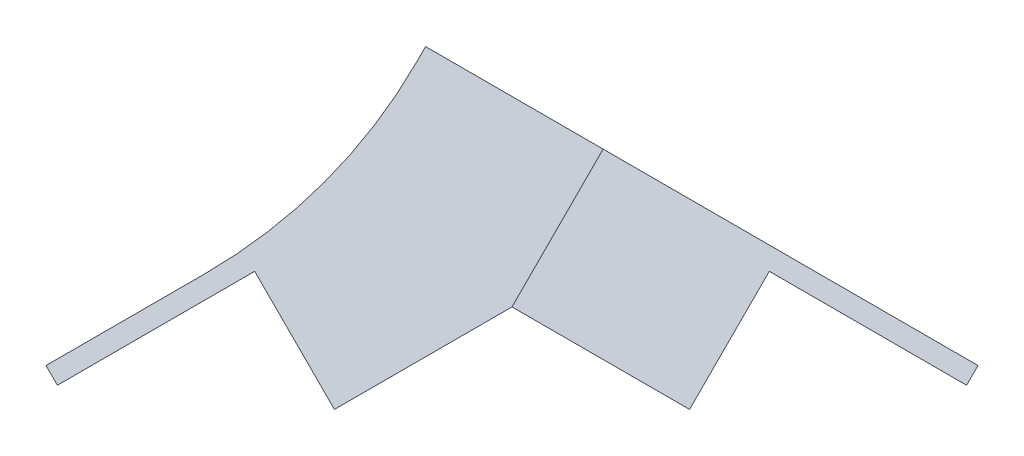
from build123d import *
from build123d.topology import SkipClean

# Parameters (mm, degrees)
STOCK_GOUX_START         = 53.391336338
STOCK_GOUX_LIKED_1_DEPTH = 20.568134432
CUT_EXTRUDE1_DEPTH       = 109.511360444
BOSS_EXTRUDE1_DEPTH      = 20.568134
FILLET1_R                = 12.7
SKETCH3_R                = 0.64999997
CUT_EXTRUDE2_DEPTH       = 149.612005727
CUT_EXTRUDE3_DEPTH       = 0.4


# Read off the part's stored shape, not the designer's step: Stock-Goux Liked-1
with BuildPart() as part:
    # Stock-Goux Liked-1 outline → Stock-Goux Liked-1 (new body)
    with BuildSketch(Plane(origin=(0, 0, 0), x_dir=(0.8164965809277512, -0.4082482904637994, -0.40824829046387656), z_dir=(0.5773502691895902, 0.5773502691895891, 0.5773502691896982)).offset(STOCK_GOUX_START)):
        Polygon((57.433440297, -119.932119095), (57.866453013, -120.182119103), (60.366452966, -115.851992166), (63.397541976, -117.601992222), (65.647541921, -113.704878), (70.147541811, -113.704878), (70.147541811, -110.204877888), (75.147541717, -110.204877888), (75.147541717, -109.704877872), (63.338140771, -109.704877872), align=None)
    extrude(amount=STOCK_GOUX_LIKED_1_DEPTH)

    # Sketch1 → Cut-Extrude1 (cut, through all)
    with BuildSketch(Plane(origin=(0, -80.401490288, 80.401490288), x_dir=(1, 0, 0), z_dir=(0, -0.7071067811865477, 0.7071067811865475))):
        Polygon((84.426495932, 5.692217571), (86.735897009, 8.958203895), (94.492614361, 3.473376455), (92.183213285, 0.207390132), align=None)
        Polygon((96.301513883, 22.486029011), (104.058231236, 17.001201571), (101.748830159, 13.735215248), (93.992112807, 19.220042687), align=None)
    extrude(amount=-CUT_EXTRUDE1_DEPTH, mode=Mode.SUBTRACT)

    # Sketch2 → Boss-Extrude1 (add)
    with SkipClean():  # the faces are left unmerged after this step: merging them gives an invalid solid
        with BuildSketch(Plane(origin=(30.825502407, 30.825502407, 30.825502407), x_dir=(-0.40824829046391425, -0.4082482904639143, 0.8164965809276746), z_dir=(-0.5773502691895895, -0.5773502691895894, -0.5773502691896983))):
            Polygon((62.183440195, -111.704877936), (65.647541921, -113.704878), (67.897541921, -109.807763683), (64.433440195, -107.807763619), align=None)
        extrude(amount=-BOSS_EXTRUDE1_DEPTH)

    # Fillet1
    fillet1_edges = [part.edges().sort_by_distance(p)[0] for p in [
        (86.689770169, -68.456355976, 92.055619581),
    ]]
    fillet(fillet1_edges, radius=FILLET1_R)

    # Sketch3 → Cut-Extrude2 (cut, through all)
    with SkipClean():  # the faces are left unmerged after this step: merging them gives an invalid solid
        with BuildSketch(Plane(origin=(53.600993525, -26.800496763, -26.800496763), x_dir=(-0.36514837167009556, 0.18257418583503127, -0.9128709291752878), z_dir=(0.8164965809277506, -0.40824829046383865, -0.4082482904638387))):
            with Locations(Location((-132.231040931, -15.066915515, 0), (0, 0, 348.463040967))):
                Circle(SKETCH3_R)
        cut_extrude2 = extrude(amount=-CUT_EXTRUDE2_DEPTH, mode=Mode.SUBTRACT)

    # Mirror1: Cut-Extrude2 across plane
    with SkipClean():  # the faces are left unmerged after this step: merging them gives an invalid solid
        add(cut_extrude2.mirror(Plane(origin=(36.763011383, 36.763011383, 36.763011383), x_dir=(-0.40824829046390154, -0.40824829046390165, 0.8164965809276874), z_dir=(0.5773502691895985, 0.5773502691895986, 0.5773502691896802))), mode=Mode.SUBTRACT)

    # Sketch4 → Cut-Extrude3 (cut)
    with SkipClean():  # the faces are left unmerged after this step: merging them gives an invalid solid
        with BuildSketch(Plane(origin=(0, -77.573063073, 77.573063073), x_dir=(1, 0, 0), z_dir=(0, 0.7071067811865477, -0.7071067811865475))):
            with BuildLine():
                Line((93.057379032, -13.173091082), (92.567645459, -13.519084672))
                Line((92.567645459, -13.519084672), (91.270169497, -11.686081867))
                Line((91.270169497, -11.686081867), (89.687757638, -12.423862316))
                add(Edge.make_bspline(
                    [(89.687757638, -12.423862316), (89.741295568, -12.46776154), (89.844942898, -12.552748714), (89.986729771, -12.686351444), (90.109493379, -12.820951582), (90.180253462, -12.914346072), (90.214380234, -12.959389159)],
                    knots=[0, 0, 0, 0, 1.102510947, 2.134417912, 3.100251258, 4, 4, 4, 4], degree=3))
                add(Edge.make_bspline(
                    [(90.214380234, -12.959389159), (90.253760272, -13.017586925), (90.331220007, -13.132060751), (90.424525722, -13.313424806), (90.499954525, -13.496549573), (90.552853451, -13.683170388), (90.588524358, -13.872165751), (90.600192512, -14.064230957), (90.594316704, -14.258572886), (90.567052813, -14.453627198), (90.522232401, -14.646119682), (90.456443819, -14.831644428), (90.37370764, -15.009053992), (90.272718514, -15.178186861), (90.151902914, -15.337992616), (90.012792553, -15.489286627), (89.855636039, -15.632722917), (89.740254809, -15.718962844), (89.681397462, -15.762954864)],
                    knots=[0, 0, 0, 0, 1.053566777, 2.072344485, 3.054154547, 4.020735706, 4.977911009, 5.934388254, 6.901994919, 7.890871114, 8.884708514, 9.862655974, 10.838946315, 11.817700602, 12.812779523, 13.839512687, 14.897909552, 16, 16, 16, 16], degree=3))
                add(Edge.make_bspline(
                    [(89.681397462, -15.762954864), (89.638861949, -15.79180454), (89.554795968, -15.84882222), (89.424554492, -15.926036449), (89.290895408, -15.991410287), (89.155300895, -16.049553503), (89.016642135, -16.097655089), (88.875174038, -16.137099385), (88.731270115, -16.168140221), (88.585356233, -16.187761829), (88.439700765, -16.199777545), (88.296040345, -16.200730613), (88.155005398, -16.193081949), (88.016337233, -16.176925914), (87.879820972, -16.150143257), (87.746101629, -16.112905095), (87.614836668, -16.066952156), (87.486042986, -16.012633338), (87.36135061, -15.94736132), (87.240735277, -15.873163467), (87.122735013, -15.792270246), (87.011070103, -15.699661066), (86.902568847, -15.599581488), (86.800066565, -15.489353904), (86.699506263, -15.37226378), (86.638126187, -15.288079908), (86.606888247, -15.245236515)],
                    knots=[0, 0, 0, 0, 1.059045057, 2.093066608, 3.116885153, 4.123102215, 5.131744447, 6.138757912, 7.148156815, 8.162686115, 9.170608983, 10.158022319, 11.120612269, 12.079785529, 13.032569554, 13.984391495, 14.937776329, 15.896949589, 16.862272095, 17.834843879, 18.814104655, 19.80760772, 20.82157244, 21.85385735, 22.907771379, 24, 24, 24, 24], degree=3))
                add(Edge.make_bspline(
                    [(86.606888247, -15.245236515), (86.571580982, -15.193252636), (86.502142451, -15.091016336), (86.41618388, -14.93004522), (86.344744771, -14.767482877), (86.292163209, -14.601805216), (86.252344887, -14.434043372), (86.233224181, -14.263324381), (86.227400474, -14.090507286), (86.239494355, -13.916834049), (86.265515908, -13.744722824), (86.30797018, -13.577552607), (86.364080119, -13.416020283), (86.435375705, -13.260390942), (86.522836864, -13.111119621), (86.623492387, -12.96724671), (86.738046259, -12.828566566), (86.824857153, -12.744064342), (86.86892751, -12.701166002)],
                    knots=[0, 0, 0, 0, 1.073683973, 2.111606131, 3.114875596, 4.105229039, 5.079452871, 6.057740752, 7.036807216, 8.032083212, 9.029653356, 10.008961322, 10.976446223, 11.949563641, 12.930560464, 13.930051518, 14.949171403, 16, 16, 16, 16], degree=3))
                Line((86.86892751, -12.701166002), (87.244177911, -13.230332668))
                add(Edge.make_bspline(
                    [(87.244177911, -13.230332668), (87.203630602, -13.274365386), (87.125511073, -13.359199998), (87.030245223, -13.496920616), (86.953711988, -13.633102202), (86.89891325, -13.771272529), (86.866072042, -13.912811297), (86.849115424, -14.058372065), (86.851210509, -14.209486442), (86.86900954, -14.363314897), (86.902300542, -14.516992644), (86.955818974, -14.664132133), (87.020988019, -14.806766078), (87.078858378, -14.893581403), (87.108070138, -14.937403982)],
                    knots=[0, 0, 0, 0, 1.151825873, 2.219138558, 3.21719232, 4.156104017, 5.071411429, 6.008616142, 6.972493179, 7.975548077, 8.988201805, 9.993150609, 10.986983969, 12, 12, 12, 12], degree=3))
                add(Edge.make_bspline(
                    [(87.108070138, -14.937403982), (87.138555874, -14.978424636), (87.19858351, -15.059195946), (87.303110462, -15.166361235), (87.415414903, -15.261227558), (87.537005465, -15.343065931), (87.667525961, -15.411983911), (87.80637932, -15.468149642), (87.954429953, -15.510207129), (88.109024438, -15.538668693), (88.267373598, -15.554853821), (88.425830222, -15.552517547), (88.58235856, -15.538339817), (88.736728883, -15.505941209), (88.888199475, -15.456572805), (89.039090754, -15.394670176), (89.187152138, -15.315407609), (89.281232645, -15.252012671), (89.329043696, -15.219795809)],
                    knots=[0, 0, 0, 0, 0.982901861, 1.935373165, 2.873857243, 3.808820726, 4.750847603, 5.710288131, 6.686831843, 7.708192972, 8.733167937, 9.745322852, 10.754049183, 11.754552243, 12.77418333, 13.817071584, 14.890651141, 16, 16, 16, 16], degree=3))
                add(Edge.make_bspline(
                    [(89.329043696, -15.219795809), (89.37068488, -15.188638571), (89.452236147, -15.127619358), (89.563587258, -15.026915322), (89.660802629, -14.919270083), (89.74548165, -14.805974644), (89.815581792, -14.685946996), (89.872085801, -14.560060608), (89.915042433, -14.428675913), (89.946372379, -14.292531636), (89.960656297, -14.1529597), (89.963134707, -14.01262796), (89.946603574, -13.872900372), (89.917624638, -13.733424144), (89.872568669, -13.594113504), (89.812188994, -13.455718618), (89.738492589, -13.316631534), (89.678065145, -13.22849889), (89.64705251, -13.183267364)],
                    knots=[0, 0, 0, 0, 1.074728317, 2.104778202, 3.097685251, 4.068882731, 5.023484141, 5.965079531, 6.915809939, 7.876988247, 8.846879582, 9.811090509, 10.772268818, 11.748712747, 12.75216451, 13.792604211, 14.867118046, 16, 16, 16, 16], degree=3))
                add(Edge.make_bspline(
                    [(89.64705251, -13.183267364), (89.618173393, -13.145235048), (89.558752843, -13.066981231), (89.459652489, -12.952007275), (89.34552654, -12.839732315), (89.220663354, -12.725514625), (89.081587528, -12.612997782), (88.930468675, -12.499599482), (88.765496982, -12.387822996), (88.650403504, -12.314998695), (88.591263247, -12.277578261)],
                    knots=[0, 0, 0, 0, 0.818651868, 1.684426275, 2.599403717, 3.561756698, 4.584719662, 5.664970434, 6.800155744, 8, 8, 8, 8], degree=3))
                Line((88.591263247, -12.277578261), (91.48132735, -10.945757348))
                Line((91.48132735, -10.945757348), (93.057379032, -13.173091082))
            make_face()
        extrude(amount=-CUT_EXTRUDE3_DEPTH, mode=Mode.SUBTRACT)


solid = part.part
